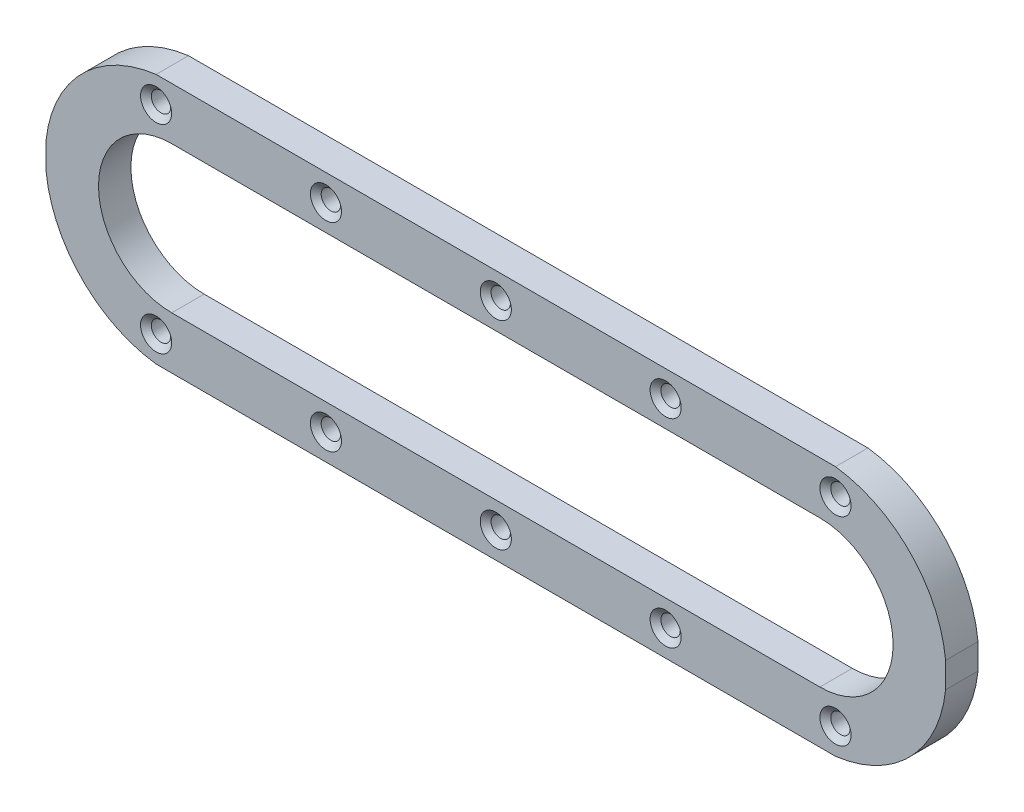
from build123d import *

# Parameters (mm, degrees)
SKETCH1_W                        = 176.276
SKETCH1_H                        = 49.149
BOSS_EXTRUDE1_DEPTH              = 6.35
CUT_EXTRUDE1_DEPTH               = 92.719875677
CUT_EXTRUDE4_DEPTH               = 92.719875677
F_10_24_TAPPED_HOLE1_D           = 3.7973
F_10_24_TAPPED_HOLE1_CSINK_D     = 6.096
F_10_24_TAPPED_HOLE1_CSINK_ANGLE = 100


with BuildPart() as part:
    # Sketch1 → Boss-Extrude1 (new body)
    with BuildSketch(Plane.XY):
        Rectangle(SKETCH1_W, SKETCH1_H)
    extrude(amount=BOSS_EXTRUDE1_DEPTH)

    # Sketch2 → Cut-Extrude1 (cut, through all)
    with BuildSketch(Plane.XY.offset(6.35)):
        with BuildLine():
            Line((63.5, -14.351), (-63.5, -14.351))
            ThreePointArc((-63.5, -14.351), (-77.851, 0), (-63.5, 14.351))
            Line((-63.5, 14.351), (63.5, 14.351))
            ThreePointArc((63.5, 14.351), (77.851, 0), (63.5, -14.351))
        make_face()
    extrude(amount=-CUT_EXTRUDE1_DEPTH, mode=Mode.SUBTRACT)

    # Sketch8 → Cut-Extrude4 (cut, through all)
    with BuildSketch(Plane.XY.offset(6.35)):
        with BuildLine():
            ThreePointArc((-88.138, 2.504831531), (-81.209963357, 17.310760321), (-66.565807357, 24.5745))
            Line((-66.565807357, 24.5745), (-88.138, 24.5745))
            Line((-88.138, 24.5745), (-88.138, 2.504831531))
        make_face()
        with BuildLine():
            Line((88.138, 24.5745), (66.565807357, 24.5745))
            ThreePointArc((66.565807357, 24.5745), (81.209963357, 17.310760321), (88.138, 2.504831531))
            Line((88.138, 2.504831531), (88.138, 24.5745))
        make_face()
        with BuildLine():
            ThreePointArc((-66.565807357, -24.5745), (-81.209963357, -17.310760321), (-88.138, -2.504831531))
            Line((-88.138, -2.504831531), (-88.138, -24.5745))
            Line((-88.138, -24.5745), (-66.565807357, -24.5745))
        make_face()
        with BuildLine():
            Line((88.138, -24.5745), (88.138, -2.504831531))
            ThreePointArc((88.138, -2.504831531), (81.209963357, -17.310760321), (66.565807357, -24.5745))
            Line((66.565807357, -24.5745), (88.138, -24.5745))
        make_face()
    extrude(amount=-CUT_EXTRUDE4_DEPTH, mode=Mode.SUBTRACT)

    # #10-24 Tapped Hole1 (through all)
    with Locations(Plane.XY.offset(6.35)):
        with Locations((-66.565807357, 19.46275), (-33.282903678, 19.46275), (0, 19.46275), (33.282903678, 19.46275), (66.565807357, 19.46275), (66.565807357, -19.46275), (33.282903678, -19.46275), (0, -19.46275), (-33.282903678, -19.46275), (-66.565807357, -19.46275)):
            CounterSinkHole(F_10_24_TAPPED_HOLE1_D / 2, F_10_24_TAPPED_HOLE1_CSINK_D / 2, counter_sink_angle=F_10_24_TAPPED_HOLE1_CSINK_ANGLE)


solid = part.part
